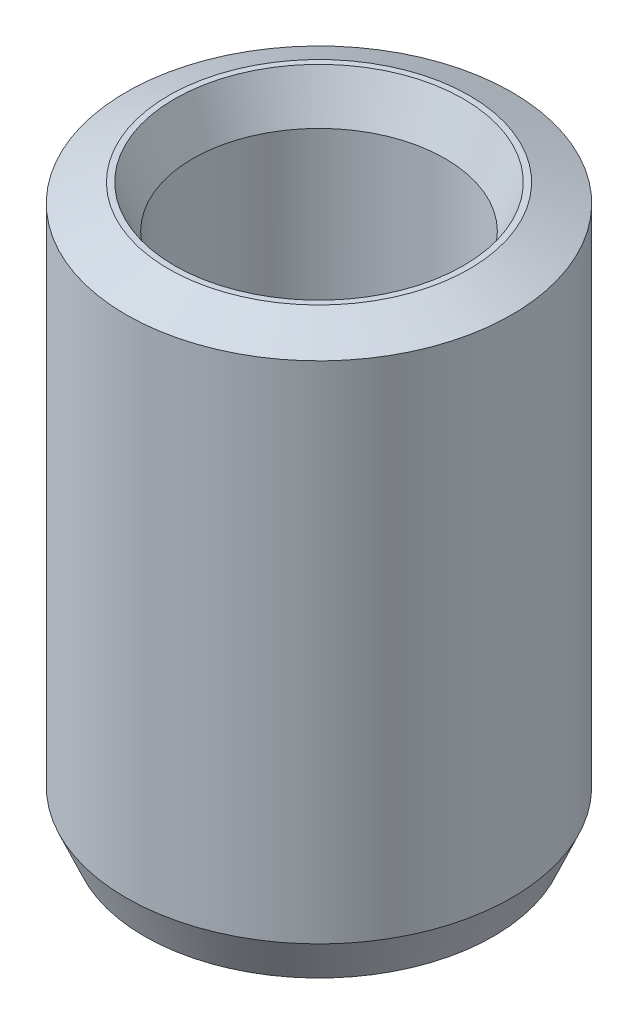
from build123d import *
from OCP.BRepFilletAPI import BRepFilletAPI_MakeChamfer

# Parameters (mm, degrees)
SKETCH1_R           = 35
BOSS_EXTRUDE1_DEPTH = 102.684958093
SKETCH2_R           = 22.891770983
CUT_EXTRUDE1_DEPTH  = 114.992107703
CHAMFER1_SIZE       = 3.326012824
CHAMFER1_SIZE2      = 7.71480416


with BuildPart() as part:
    # Sketch1 → Boss-Extrude1 (new body)
    with BuildSketch(Plane(origin=(0, 0, 0), x_dir=(1, 0, 0), z_dir=(0, 1, 0))):
        Circle(SKETCH1_R)
    extrude(amount=BOSS_EXTRUDE1_DEPTH)

    # Sketch2 → Cut-Extrude1 (cut, through all)
    with BuildSketch(Plane(origin=(0, 0, 0), x_dir=(1, 0, 0), z_dir=(0, 1, 0))):
        Circle(SKETCH2_R)
    extrude(amount=CUT_EXTRUDE1_DEPTH, mode=Mode.SUBTRACT)

    # Chamfer1: one chamfer whose edges measure the first distance from different faces: ONE call of the kernel's chamfer builder (chamfer() names one face for all edges)
    chamfer1_edges_1 = [part.edges().sort_by_distance(p)[0] for p in [
        (-22.891770983, 102.684958093, 0),
    ]]
    chamfer1_side_1 = [part.faces().sort_by_distance(p)[0] for p in [
        (-34.010050506, 102.684958093, 0),
    ]]
    chamfer1_edges_2 = [part.edges().sort_by_distance(p)[0] for p in [
        (-22.891770983, 0, 0),
    ]]
    chamfer1_side_2 = [part.faces().sort_by_distance(p)[0] for p in [
        (-22.891770983, 51.342479046, 0),
    ]]
    chamfer1_edges_3 = [part.edges().sort_by_distance(p)[0] for p in [
        (-35, 0, 0),
    ]]
    chamfer1_side_3 = [part.faces().sort_by_distance(p)[0] for p in [
        (-34.010050506, 0, 0),
    ]]
    chamfer1_edges_4 = [part.edges().sort_by_distance(p)[0] for p in [
        (-35, 102.684958093, 0),
    ]]
    chamfer1_side_4 = [part.faces().sort_by_distance(p)[0] for p in [
        (-35, 51.342479046, 0),
    ]]
    chamfer1 = BRepFilletAPI_MakeChamfer(part.part.solid().wrapped)
    for e in chamfer1_edges_1:
        chamfer1.Add(CHAMFER1_SIZE, CHAMFER1_SIZE2, e.wrapped, chamfer1_side_1[0].wrapped)  # the first distance lies on this face
    for e in chamfer1_edges_2:
        chamfer1.Add(CHAMFER1_SIZE, CHAMFER1_SIZE2, e.wrapped, chamfer1_side_2[0].wrapped)  # the first distance lies on this face
    for e in chamfer1_edges_3:
        chamfer1.Add(CHAMFER1_SIZE, CHAMFER1_SIZE2, e.wrapped, chamfer1_side_3[0].wrapped)  # the first distance lies on this face
    for e in chamfer1_edges_4:
        chamfer1.Add(CHAMFER1_SIZE, CHAMFER1_SIZE2, e.wrapped, chamfer1_side_4[0].wrapped)  # the first distance lies on this face
    add(Compound.cast(chamfer1.Shape()), mode=Mode.REPLACE)


solid = part.part
